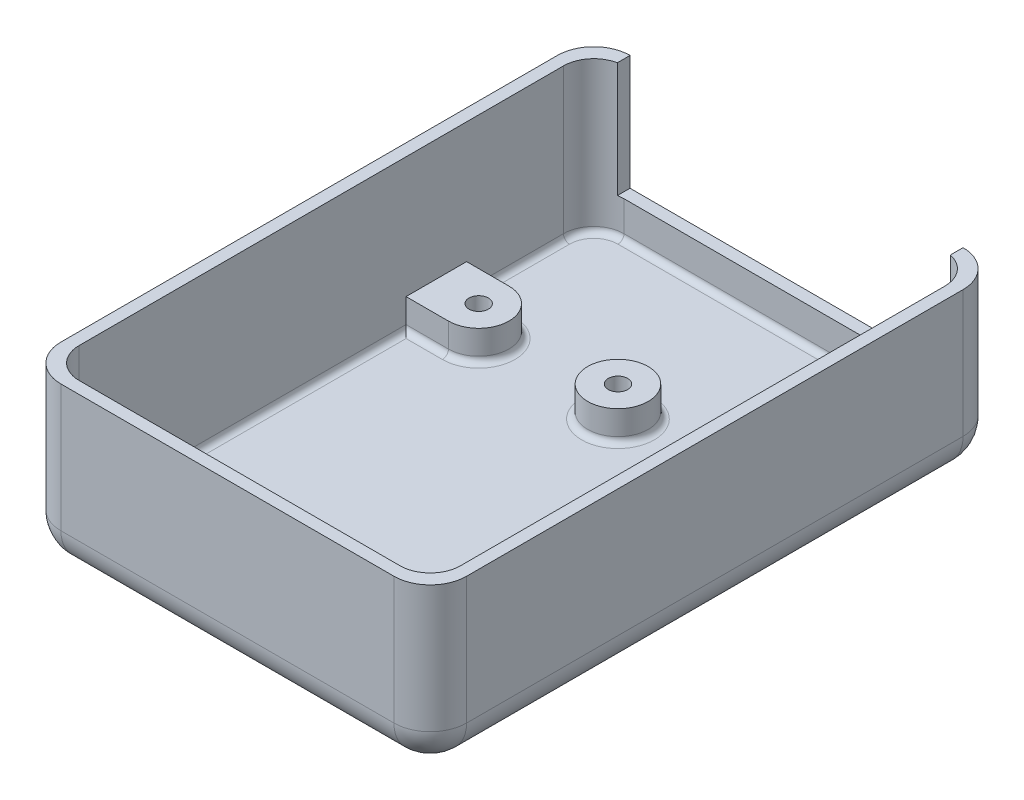
from build123d import *

# Parameters (mm, degrees)
SKETCH_1_W          = 67
SKETCH_1_H          = 94
SKETCH_1_R          = 1.6
EXTRUDE_1_DEPTH     = 2
SKETCH_1_3_W        = 67
SKETCH_1_3_H        = 94
SKETCH_1_3_W_2      = 63
SKETCH_1_3_H_2      = 90
EXTRUDE_2_DEPTH     = 25
EXTRUDE_START       = 5
SKETCH_1_4_R        = 1.6
SKETCH_1_4_R_2      = 5
EXTRUDE_3_DEPTH     = 5
CUT_EXTRUDE_1_REACH = 115.248
SKETCH_2_W          = 55
SKETCH_2_H          = 19
FILLET_7_R          = 5
FILLET_8_R          = 1
FILLET_9_R          = 6
FILLET_11_R         = 6


with BuildPart() as part:
    # Эскиз1 → Бобышка-Вытянуть1 (new body)
    with BuildSketch(Plane(origin=(0, 0, 0), x_dir=(1, 0, 0), z_dir=(0, 1, 0))):
        with Locations((24.5, 39)):
            Rectangle(SKETCH_1_W, SKETCH_1_H)
        with Locations(Location((0, 0, 0), (0, 0, 270))):
            Circle(SKETCH_1_R, mode=Mode.SUBTRACT)
        with Locations(Location((49, 0, 0), (0, 0, 270))):
            Circle(SKETCH_1_R, mode=Mode.SUBTRACT)
        with Locations(Location((49, 58, 0), (0, 0, 270))):
            Circle(SKETCH_1_R, mode=Mode.SUBTRACT)
        with Locations(Location((0, 58, 0), (0, 0, 270))):
            Circle(SKETCH_1_R, mode=Mode.SUBTRACT)
        with Locations(Location((23, 58, 0), (0, 0, 270))):
            Circle(SKETCH_1_R, mode=Mode.SUBTRACT)
        with Locations(Location((23, 0, 0), (0, 0, 270))):
            Circle(SKETCH_1_R, mode=Mode.SUBTRACT)
    extrude(amount=-EXTRUDE_1_DEPTH)

    # Эскиз1<3> → Бобышка-Вытянуть2 (add)
    with BuildSketch(Plane(origin=(0, 0, 0), x_dir=(1, 0, 0), z_dir=(0, 1, 0))):
        with Locations((24.5, 39)):
            Rectangle(SKETCH_1_3_W, SKETCH_1_3_H)
        with Locations((24.5, 39)):
            Rectangle(SKETCH_1_3_W_2, SKETCH_1_3_H_2, mode=Mode.SUBTRACT)
    extrude(amount=EXTRUDE_2_DEPTH)

    # Эскиз1<4> → Бобышка-Вытянуть3 (add)
    # profile 1 of 6: a face of its own
    with BuildSketch(Plane(origin=(0, 0, 0), x_dir=(1, 0, 0), z_dir=(0, 1, 0)).offset(EXTRUDE_START)):
        with BuildLine():
            Line((-7, 5), (-7, -6))
            Line((-7, -6), (5, -6))
            Line((5, -6), (5, 0))
            ThreePointArc((5, 0), (3.535533906, 3.535533906), (0, 5))
            Line((0, 5), (-7, 5))
        make_face()
        with Locations(Location((0, 0, 0), (0, 0, 270))):
            Circle(SKETCH_1_4_R, mode=Mode.SUBTRACT)
    # profile 2 of 6: a face of its own
    with BuildSketch(Plane(origin=(0, 0, 0), x_dir=(1, 0, 0), z_dir=(0, 1, 0)).offset(EXTRUDE_START)):
        with BuildLine():
            Line((18, 0), (18, -6))
            Line((18, -6), (28, -6))
            Line((28, -6), (28, 0))
            ThreePointArc((28, 0), (23, 5), (18, 0))
        make_face()
        with Locations(Location((23, 0, 0), (0, 0, 270))):
            Circle(SKETCH_1_4_R, mode=Mode.SUBTRACT)
    # profile 3 of 6: a face of its own
    with BuildSketch(Plane(origin=(0, 0, 0), x_dir=(1, 0, 0), z_dir=(0, 1, 0)).offset(EXTRUDE_START)):
        with BuildLine():
            Line((-7, 63), (-7, 53))
            Line((-7, 53), (0, 53))
            ThreePointArc((0, 53), (5, 58), (0, 63))
            Line((0, 63), (-7, 63))
        make_face()
        with Locations(Location((0, 58, 0), (0, 0, 270))):
            Circle(SKETCH_1_4_R, mode=Mode.SUBTRACT)
    # profile 4 of 6: a face of its own
    with BuildSketch(Plane(origin=(0, 0, 0), x_dir=(1, 0, 0), z_dir=(0, 1, 0)).offset(EXTRUDE_START)):
        with BuildLine():
            Line((44, 0), (44, -6))
            Line((44, -6), (56, -6))
            Line((56, -6), (56, 5))
            Line((56, 5), (49, 5))
            ThreePointArc((49, 5), (45.464466094, 3.535533906), (44, 0))
        make_face()
        with Locations(Location((49, 0, 0), (0, 0, 270))):
            Circle(SKETCH_1_4_R, mode=Mode.SUBTRACT)
    # profile 5 of 6: a face of its own
    with BuildSketch(Plane(origin=(0, 0, 0), x_dir=(1, 0, 0), z_dir=(0, 1, 0)).offset(EXTRUDE_START)):
        with BuildLine():
            Line((56, 53), (56, 63))
            Line((56, 63), (49, 63))
            ThreePointArc((49, 63), (44, 58), (49, 53))
            Line((49, 53), (56, 53))
        make_face()
        with Locations(Location((49, 58, 0), (0, 0, 270))):
            Circle(SKETCH_1_4_R, mode=Mode.SUBTRACT)
    # profile 6 of 6: a face of its own
    with BuildSketch(Plane(origin=(0, 0, 0), x_dir=(1, 0, 0), z_dir=(0, 1, 0)).offset(EXTRUDE_START)):
        with Locations(Location((23, 58, 0), (0, 0, 270))):
            Circle(SKETCH_1_4_R_2)
        with Locations(Location((23, 58, 0), (0, 0, 270))):
            Circle(SKETCH_1_4_R, mode=Mode.SUBTRACT)
    extrude(amount=-EXTRUDE_3_DEPTH)

    # Эскиз2 → Вырез-Вытянуть1 (cut, up to next)
    with BuildSketch(Plane(origin=(0, 0, -86), x_dir=(-1, 0, 0), z_dir=(0, 0, -1)), mode=Mode.PRIVATE) as cut_extrude_1_sk1:
        with Locations((-24.5, 15.5)):
            Rectangle(SKETCH_2_W, SKETCH_2_H)
    cut_extrude_1_tool1 = extrude(cut_extrude_1_sk1.sketch, amount=-CUT_EXTRUDE_1_REACH, mode=Mode.PRIVATE) & part.part
    add(cut_extrude_1_tool1.solids().sort_by_distance((24.5, 15.5, -86))[0], mode=Mode.SUBTRACT)

    # Скругление7
    fillet_7_edges = [part.edges().sort_by_distance(p)[0] for p in [
        (56, 12.5, -84),
        (-7, 12.5, -84),
        (56, 15, 6),
        (-7, 15, 6),
    ]]
    fillet(fillet_7_edges, radius=FILLET_7_R)

    # Скругление8
    fillet_8_edges = [part.edges().sort_by_distance(p)[0] for p in [
        (5, 0, 3),
        (36, 0, 6),
        (23, 0, -5),
        (18, 0, 3),
        (28, 0, 3),
        (56, 0, -29),
        (45.464466094, 0, -3.535533906),
        (44, 0, 3),
        (52.5, 0, -5),
        (24.5, 0, -84),
        (-5.535533906, 0, -82.535533906),
        (54.535533906, 0, -82.535533906),
        (-7, 0, -71),
        (5, 0, -58),
        (-3.5, 0, -63),
        (-3.5, 0, -53),
        (23, 0, -63),
        (56, 0, -71),
        (44, 0, -58),
        (52.5, 0, -53),
        (52.5, 0, -63),
        (-7, 0, -29),
        (11.5, 0, 6),
        (3.535533906, 0, -3.535533906),
        (-3.5, 0, -5),
    ]]
    fillet(fillet_8_edges, radius=FILLET_8_R)

    # Скругление9
    fillet_9_edges = [part.edges().sort_by_distance(p)[0] for p in [
        (58, 11.5, 8),
        (-9, 11.5, 8),
        (-9, -2, -39),
        (24.5, -2, 8),
        (58, -2, -39),
        (24.5, -2, -86),
    ]]
    fillet(fillet_9_edges, radius=FILLET_9_R)

    # Скругление11
    # the kernel refuses this fillet: 6 mm, written as the material it takes off along each edge
    with BuildSketch(Plane(origin=(-3, 4, -80), x_dir=(-1, 0, 0), z_dir=(0, 0, -1))) as fillet_11_piece_1_section:
        Polygon((0, 0), (FILLET_11_R, 0), (FILLET_11_R, -FILLET_11_R), (0, -FILLET_11_R), align=None)
    fillet_11_piece_1 = extrude(amount=FILLET_11_R, mode=Mode.PRIVATE)
    fillet_11_piece_1 = fillet_11_piece_1 - Plane(origin=(-3, 4, -80), x_dir=(0.7071067811865475, 0.7071067811865475, 0), z_dir=(0, 0, -1)) * Sphere(FILLET_11_R, mode=Mode.PRIVATE)
    add(fillet_11_piece_1, mode=Mode.SUBTRACT)
    with BuildSketch(Plane(origin=(52, 4, -80), x_dir=(0, 0, -1), z_dir=(1, 0, 0))) as fillet_11_piece_2_section:
        Polygon((0, 0), (FILLET_11_R, 0), (FILLET_11_R, -FILLET_11_R), (0, -FILLET_11_R), align=None)
    fillet_11_piece_2 = extrude(amount=FILLET_11_R, mode=Mode.PRIVATE)
    fillet_11_piece_2 = fillet_11_piece_2 - Plane(origin=(52, 4, -80), x_dir=(0, 0.7071067811865475, 0.7071067811865475), z_dir=(1, 0, 0)) * Sphere(FILLET_11_R, mode=Mode.PRIVATE)
    add(fillet_11_piece_2, mode=Mode.SUBTRACT)
    with BuildSketch(Plane(origin=(-9, 40, -86), x_dir=(1, 0, 0), z_dir=(0, -1, 0)), Plane(origin=(58, 40, -86), x_dir=(0, 0, 1), z_dir=(0, -1, 0))) as fillet_11_piece_3:
        with BuildLine():
            CenterArc((FILLET_11_R, FILLET_11_R), FILLET_11_R, 180, 90)
            Line((0, FILLET_11_R), (0, 0))
            Line((0, 0), (FILLET_11_R, 0))
        make_face()
    extrude(amount=36, mode=Mode.SUBTRACT)


solid = part.part
